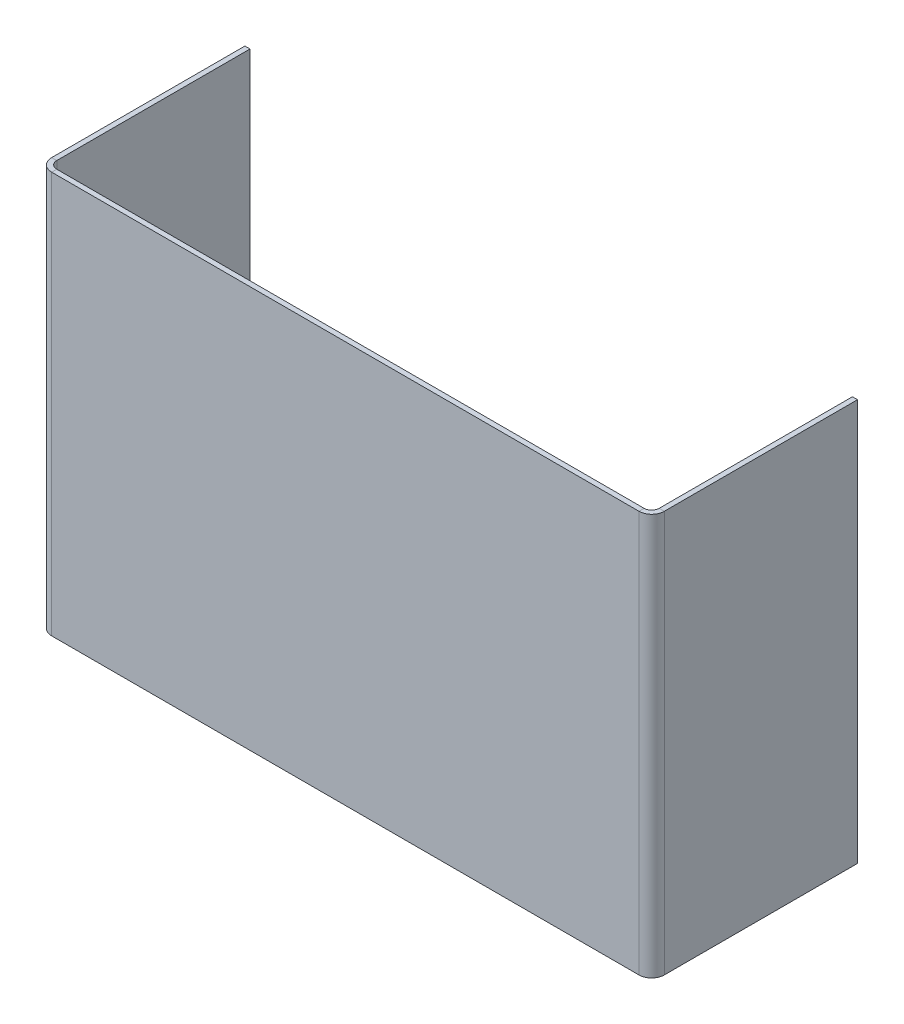
from build123d import *

# Parameters (mm, degrees)
SKETCH1_W                      = 152.4
SKETCH1_H                      = 101.6
BASE_FLANGE1_DEPTH             = 1.29032
EDGE_FLANGE1_STRIP_W           = 8.97128
EDGE_FLANGE1_STRIP_H           = 1.29032
EDGE_FLANGE1_STRIP_CUT_DEPTH   = 101.6
EDGE_FLANGE1_STRIP_2_W         = 8.97128
EDGE_FLANGE1_STRIP_2_H         = 1.29032
EDGE_FLANGE1_STRIP_CUT_2_DEPTH = 101.6
EDGE_FLANGE1_DEPTH             = 101.6
EDGE_FLANGE1_BEND_DEPTH        = 101.6


# Sheet-metal steps are written as plain solids
with BuildPart() as part:
    # Sketch1 → Base-Flange1 (new body)
    with BuildSketch(Plane.XY):
        Rectangle(SKETCH1_W, SKETCH1_H)
    extrude(amount=-BASE_FLANGE1_DEPTH)

    # Edge-Flange1 strip (across the edge) → Edge-Flange1 strip cut (cut)
    with BuildSketch(Plane(origin=(-76.2, -50.8, -1.29032), x_dir=(1, 0, 0), z_dir=(0, 1, 0))):
        with Locations((-2.58064, -0.64516)):
            Rectangle(EDGE_FLANGE1_STRIP_W, EDGE_FLANGE1_STRIP_H)
    extrude(amount=EDGE_FLANGE1_STRIP_CUT_DEPTH, mode=Mode.SUBTRACT)

    # Edge-Flange1 strip 2 (across the edge) → Edge-Flange1 strip cut 2 (cut)
    with BuildSketch(Plane(origin=(76.2, 50.8, -1.29032), x_dir=(-1, 0, 0), z_dir=(0, -1, 0))):
        with Locations((-2.58064, -0.64516)):
            Rectangle(EDGE_FLANGE1_STRIP_2_W, EDGE_FLANGE1_STRIP_2_H)
    extrude(amount=EDGE_FLANGE1_STRIP_CUT_2_DEPTH, mode=Mode.SUBTRACT)

    # Edge-Flange1 section (across the edge) → Edge-Flange1 (add)
    with BuildSketch(Plane(origin=(-76.2, -50.8, -1.29032), x_dir=(1, 0, 0), z_dir=(0, 1, 0))):
        with BuildLine():
            Line((-1.29032, 1.905), (-1.29032, 50.8))
            Line((-1.29032, 50.8), (0, 50.8))
            Line((0, 50.8), (0, 1.905))
            ThreePointArc((0, 1.905), (0.557961582, 0.557961582), (1.905, 0))
            Line((1.905, 0), (1.905, -1.29032))
            ThreePointArc((1.905, -1.29032), (-0.35443244, -0.35443244), (-1.29032, 1.905))
        make_face()
    extrude(amount=EDGE_FLANGE1_DEPTH)

    # Edge-Flange1 section 2 (across the edge) → Edge-Flange1 bend (add)
    with BuildSketch(Plane(origin=(76.2, 50.8, -1.29032), x_dir=(-1, 0, 0), z_dir=(0, -1, 0))):
        with BuildLine():
            Line((-1.29032, 1.905), (-1.29032, 50.8))
            Line((-1.29032, 50.8), (0, 50.8))
            Line((0, 50.8), (0, 1.905))
            ThreePointArc((0, 1.905), (0.557961582, 0.557961582), (1.905, 0))
            Line((1.905, 0), (1.905, -1.29032))
            ThreePointArc((1.905, -1.29032), (-0.35443244, -0.35443244), (-1.29032, 1.905))
        make_face()
    extrude(amount=EDGE_FLANGE1_BEND_DEPTH)


solid = part.part
